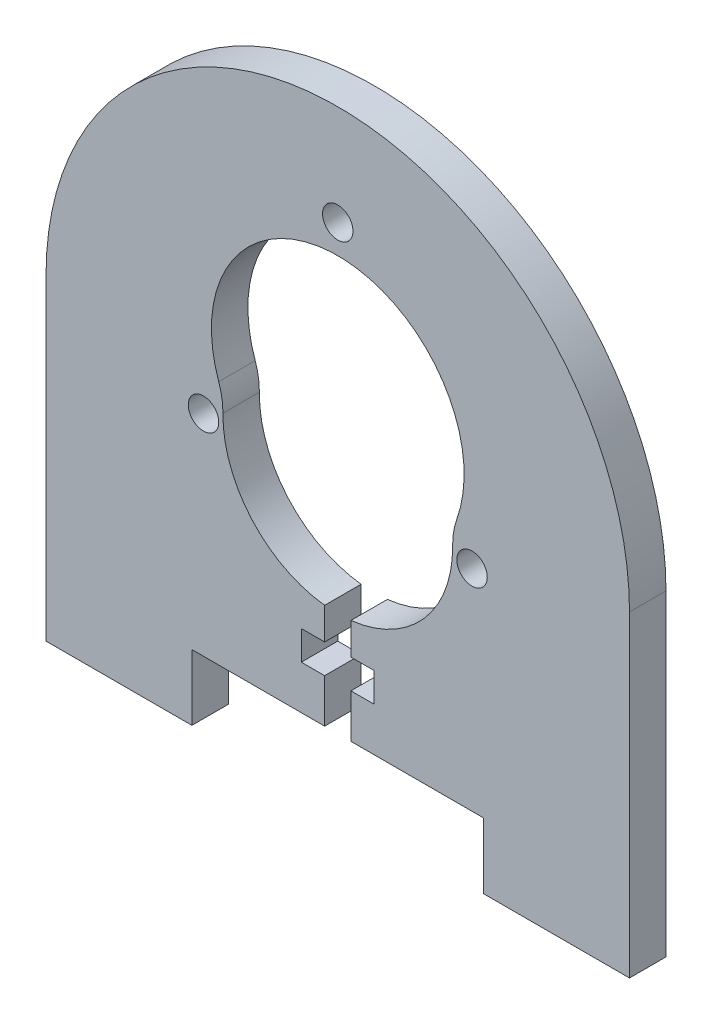
from build123d import *

# Parameters (mm, degrees)
BOSS_EXTRUDE1_DEPTH = 3.175
CUT_EXTRUDE1_REACH  = 48.818
SKETCH2_R           = 11
CUT_EXTRUDE2_REACH  = 48.818
SKETCH3_W           = 25.4
SKETCH3_H           = 5.715
CUT_EXTRUDE4_REACH  = 48.818
SKETCH6_R           = 1.3250037
CUT_EXTRUDE6_DEPTH  = 47.817591721
SKETCH7_R           = 10
CUT_EXTRUDE7_DEPTH  = 47.817591721
FILLET1_R           = 6.35


with BuildPart() as part:
    # Sketch1 → Boss-Extrude1 (new body)
    with BuildSketch(Plane.XY):
        with BuildLine():
            Line((25.4, -13.800079969), (-25.4, -13.800079969))
            Line((-25.4, -13.800079969), (-25.4, 13.800079969))
            ThreePointArc((-25.4, 13.800079969), (0, 39.200079969), (25.4, 13.800079969))
            Line((25.4, 13.800079969), (25.4, -13.800079969))
        make_face()
    extrude(amount=BOSS_EXTRUDE1_DEPTH)

    # Sketch2 → Cut-Extrude1 (cut, up to next)
    with BuildSketch(Plane.XY.offset(3.175), mode=Mode.PRIVATE) as cut_extrude1_sk1:
        with Locations((0, 16.964919969)):
            Circle(SKETCH2_R)
    cut_extrude1_tool1 = extrude(cut_extrude1_sk1.sketch, amount=-CUT_EXTRUDE1_REACH, mode=Mode.PRIVATE) & part.part
    add(cut_extrude1_tool1.solids().sort_by_distance((0, 16.96492, 3.175))[0], mode=Mode.SUBTRACT)

    # Sketch3 → Cut-Extrude2 (cut, up to next)
    with BuildSketch(Plane.XY.offset(3.175), mode=Mode.PRIVATE) as cut_extrude2_sk1:
        with Locations((0, -10.942579969)):
            Rectangle(SKETCH3_W, SKETCH3_H)
    cut_extrude2_tool1 = extrude(cut_extrude2_sk1.sketch, amount=-CUT_EXTRUDE2_REACH, mode=Mode.PRIVATE) & part.part
    add(cut_extrude2_tool1.solids().sort_by_distance((0, -10.94258, 3.175))[0], mode=Mode.SUBTRACT)

    # Sketch5 → Cut-Extrude4 (cut, up to next)
    with BuildSketch(Plane.XY.offset(3.175), mode=Mode.PRIVATE) as cut_extrude4_sk1:
        Polygon((3.175, -4.275079969), (1.143, -4.275079969), (1.143, -8.085079969), (-1.143, -8.085079969), (-1.143, -4.275079969), (-3.175, -4.275079969), (-3.175, -1.735079969), (-1.143, -1.735079969), (-1.143, 7.154920031), (1.143, 7.154920031), (1.143, -1.735079969), (3.175, -1.735079969), align=None)
    cut_extrude4_tool1 = extrude(cut_extrude4_sk1.sketch, amount=-CUT_EXTRUDE4_REACH, mode=Mode.PRIVATE) & part.part
    add(cut_extrude4_tool1.solids().sort_by_distance((0, -1.045651, 3.175))[0], mode=Mode.SUBTRACT)

    # Sketch6 → Cut-Extrude6 (cut, through all)
    with BuildSketch(Plane.XY):
        with Locations((0, 30.464919969)):
            Circle(SKETCH6_R)
        with Locations((11.691342951, 10.214919969)):
            Circle(SKETCH6_R)
        with Locations((-11.691342951, 10.214919969)):
            Circle(SKETCH6_R)
    extrude(amount=CUT_EXTRUDE6_DEPTH, mode=Mode.SUBTRACT)

    # Sketch7 → Cut-Extrude7 (cut, through all)
    with BuildSketch(Plane.XY):
        with Locations((0, 10.964920031)):
            Circle(SKETCH7_R)
    extrude(amount=CUT_EXTRUDE7_DEPTH, mode=Mode.SUBTRACT)

    # Fillet1
    fillet1_edges = [part.edges().sort_by_distance(p)[0] for p in [
        (-9.921567423, 12.214919982, 1.5875),
        (9.921567423, 12.214919982, 1.5875),
    ]]
    fillet(fillet1_edges, radius=FILLET1_R)


solid = part.part
